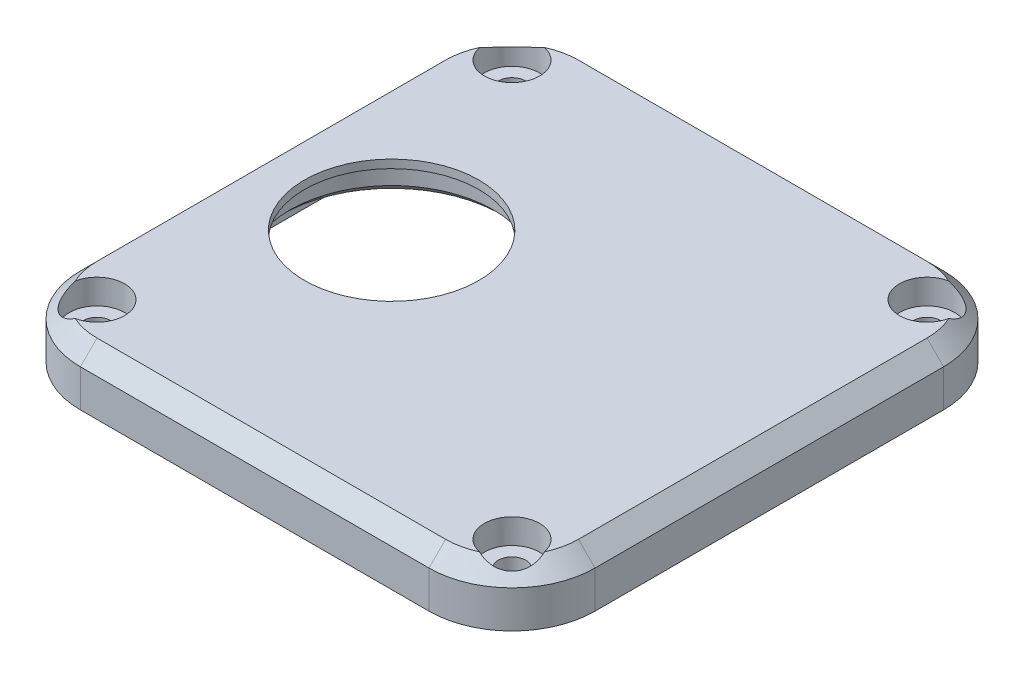
from build123d import *

# Parameters (mm, degrees)
CROQUIS1_W              = 62
CROQUIS1_H              = 62
SALIENTE_EXTRUIR1_DEPTH = 6.5
REDONDEO1_R             = 10
REDONDEO2_R             = 10
VACIADO1_T              = -2.5
SALIENTE_EXTRUIR2_DEPTH = 5
CROQUIS6_R              = 12.25
CORTAR_EXTRUIR4_DEPTH   = 4
CROQUIS8_R              = 10.5
CORTAR_EXTRUIR7_DEPTH   = 70.535961919
CROQUIS9_R              = 1.65
CORTAR_EXTRUIR8_DEPTH   = 70.622194737
CROQUIS10_R             = 3.325
CORTAR_EXTRUIR9_DEPTH   = 3
SALIENTE_EXTRUIR3_START = 1.5
CROQUIS11_R             = 3.910048181
CROQUIS11_R_2           = 1.65
CROQUIS11_R_3           = 3.794929079
CROQUIS11_R_4           = 3.596875763
SALIENTE_EXTRUIR3_DEPTH = 1.5
REDONDEO3_R             = 2
CHAFL_N1_SIZE           = 1
CHAFL_N2_SIZE           = 2
CROQUIS12_R             = 5.75
CORTAR_EXTRUIR10_DEPTH  = 4
CHAFL_N3_SIZE           = 1
CORTAR_EXTRUIR11_DEPTH  = 3
CHAFL_N4_SIZE           = 2


with BuildPart() as part:
    # Croquis1 → Saliente-Extruir1 (new body)
    with BuildSketch(Plane(origin=(0, 0, 0), x_dir=(1, 0, 0), z_dir=(0, 1, 0))):
        with Locations((31, 0)):
            Rectangle(CROQUIS1_W, CROQUIS1_H)
    extrude(amount=SALIENTE_EXTRUIR1_DEPTH)

    # Redondeo1
    redondeo1_edges = [part.edges().sort_by_distance(p)[0] for p in [
        (62, 3.25, -31),
        (62, 3.25, 31),
    ]]
    fillet(redondeo1_edges, radius=REDONDEO1_R)

    # Redondeo2
    redondeo2_edges = [part.edges().sort_by_distance(p)[0] for p in [
        (0, 3.25, -31),
        (0, 3.25, 31),
    ]]
    fillet(redondeo2_edges, radius=REDONDEO2_R)

    # Vaciado1
    vaciado1_openings = [part.faces().sort_by_distance(p)[0] for p in [
        (31, 6.5, 0),
        (31, 0, 0),
    ]]
    offset(amount=VACIADO1_T, openings=vaciado1_openings, kind=Kind.INTERSECTION)

    # Croquis4 → Saliente-Extruir2 (add)
    with BuildSketch(Plane.XZ.offset(-6.5)):
        with BuildLine():
            Line((7.085748882, 28.5), (54.5, 28.5))
            ThreePointArc((54.5, 28.5), (58.035533906, 27.035533906), (59.5, 23.5))
            Line((59.5, 23.5), (59.5, -23.5))
            ThreePointArc((59.5, -23.5), (58.035533906, -27.035533906), (54.5, -28.5))
            Line((54.5, -28.5), (7.085748882, -28.5))
            ThreePointArc((7.085748882, -28.5), (3.550214976, -27.035533906), (2.085748882, -23.5))
            Line((2.085748882, -23.5), (2.085748882, 23.5))
            ThreePointArc((2.085748882, 23.5), (3.550214976, 27.035533906), (7.085748882, 28.5))
        make_face()
    extrude(amount=SALIENTE_EXTRUIR2_DEPTH)

    # Croquis6 → Cortar-Extruir4 (cut)
    with BuildSketch(Plane(origin=(0, 1.5, 0), x_dir=(-1, 0, 0), z_dir=(0, -1, 0))):
        with Locations(Location((-16.5, 0, 0), (0, 0, 90))):
            Circle(CROQUIS6_R)
    extrude(amount=-CORTAR_EXTRUIR4_DEPTH, mode=Mode.SUBTRACT)

    # Croquis8 → Cortar-Extruir7 (cut, through all)
    with BuildSketch(Plane.XZ.offset(-5.5)):
        with Locations(Location((16.5, 0, 0), (0, 0, 270))):
            Circle(CROQUIS8_R)
    extrude(amount=-CORTAR_EXTRUIR7_DEPTH, mode=Mode.SUBTRACT)

    # Croquis9 → Cortar-Extruir8 (cut, through all)
    with BuildSketch(Plane.XZ):
        with Locations(Location((6, 25, 0), (0, 0, 270))):
            Circle(CROQUIS9_R)
        with Locations(Location((56, 25, 0), (0, 0, 270))):
            Circle(CROQUIS9_R)
        with Locations(Location((56, -25, 0), (0, 0, 270))):
            Circle(CROQUIS9_R)
        with Locations(Location((6, -25, 0), (0, 0, 270))):
            Circle(CROQUIS9_R)
    extrude(amount=-CORTAR_EXTRUIR8_DEPTH, mode=Mode.SUBTRACT)

    # Croquis10 → Cortar-Extruir9 (cut)
    with BuildSketch(Plane(origin=(0, 6.5, 0), x_dir=(1, 0, 0), z_dir=(0, 1, 0))):
        with Locations(Location((6, 25, 0), (0, 0, 270))):
            Circle(CROQUIS10_R)
        with Locations(Location((6, -25, 0), (0, 0, 270))):
            Circle(CROQUIS10_R)
        with Locations(Location((56, -25, 0), (0, 0, 270))):
            Circle(CROQUIS10_R)
        with Locations(Location((56, 25, 0), (0, 0, 270))):
            Circle(CROQUIS10_R)
    extrude(amount=-CORTAR_EXTRUIR9_DEPTH, mode=Mode.SUBTRACT)

    # Croquis11 → Saliente-Extruir3 (add)
    # profile 1 of 4: a face of its own
    with BuildSketch(Plane.XZ.offset(-1.5).offset(SALIENTE_EXTRUIR3_START)):
        with Locations((6, 25)):
            Circle(CROQUIS11_R)
        with Locations(Location((6, 25, 0), (0, 0, 270))):
            Circle(CROQUIS11_R_2, mode=Mode.SUBTRACT)
    # profile 2 of 4: a face of its own
    with BuildSketch(Plane.XZ.offset(-1.5).offset(SALIENTE_EXTRUIR3_START)):
        with Locations((6, -25)):
            Circle(CROQUIS11_R_3)
        with Locations(Location((6, -25, 0), (0, 0, 270))):
            Circle(CROQUIS11_R_2, mode=Mode.SUBTRACT)
    # profile 3 of 4: a face of its own
    with BuildSketch(Plane.XZ.offset(-1.5).offset(SALIENTE_EXTRUIR3_START)):
        with Locations((56, -25)):
            Circle(CROQUIS11_R_4)
        with Locations(Location((56, -25, 0), (0, 0, 270))):
            Circle(CROQUIS11_R_2, mode=Mode.SUBTRACT)
    # profile 4 of 4: a face of its own
    with BuildSketch(Plane.XZ.offset(-1.5).offset(SALIENTE_EXTRUIR3_START)):
        with Locations((56, 25)):
            Circle(CROQUIS11_R_4)
        with Locations(Location((56, 25, 0), (0, 0, 270))):
            Circle(CROQUIS11_R_2, mode=Mode.SUBTRACT)
    extrude(amount=-SALIENTE_EXTRUIR3_DEPTH)

    # Redondeo3
    redondeo3_edges = [part.edges().sort_by_distance(p)[0] for p in [
        (54.263904065, 0.75, 28.150156529),
        (59.150156529, 0.75, 23.263904065),
        (59.150156529, 0.75, -23.263904065),
        (54.263904065, 0.75, -28.150156529),
        (7.996337674, 0.75, -28.227401835),
        (2.772598165, 0.75, -23.003662326),
        (2.732409322, 0.75, 22.852599726),
        (8.147400274, 0.75, 28.267590678),
    ]]
    fillet(redondeo3_edges, radius=REDONDEO3_R)

    # Chaflán1
    chafl_n1_edges = [part.edges().sort_by_distance(p)[0] for p in [
        (16.5, 1.5, 12.25),
    ]]
    chamfer(chafl_n1_edges, length=CHAFL_N1_SIZE)

    # Chaflán2
    # the kernel refuses this chamfer: 2 mm, written as the material it takes off along each edge
    with BuildSketch(Plane(origin=(10, 6.5, -31), x_dir=(0, -0.9996219169112968, -0.027495876610585623), z_dir=(1, 0, 0)), Plane(origin=(62, 6.5, -21), x_dir=(0.027495876610585623, -0.9996219169112968, 0), z_dir=(0, 0, 1)), Plane(origin=(52, 6.5, 31), x_dir=(0, -0.9996219169112968, 0.027495876610585623), z_dir=(-1, 0, 0)), Plane(origin=(0, 6.5, 21), x_dir=(-0.027495876610586365, -0.9996219169112968, 0), z_dir=(0, 0, -1))) as chafl_n2_piece_1:
        Polygon((CHAFL_N2_SIZE * 0.999621916911, -CHAFL_N2_SIZE * 0.0274958766106), (-CHAFL_N2_SIZE * 0.0274958766106, -CHAFL_N2_SIZE * 0.999621916911), (0, 0), align=None)
    extrude(amount=42, mode=Mode.SUBTRACT)
    with BuildSketch(Plane(origin=(52, 6.5, 21), x_dir=(1, 0, 0), z_dir=(0, 0, -1))) as chafl_n2_piece_2:
        Polygon((10, CHAFL_N2_SIZE), (10 - CHAFL_N2_SIZE, 0), (10, 0), align=None)
    revolve(axis=Axis((52, 6.5, 21), (0, -1, 0)), revolution_arc=90, mode=Mode.SUBTRACT)
    with BuildSketch(Plane(origin=(52, 6.5, -21), x_dir=(0, 0, -1), z_dir=(-1, 0, 0))) as chafl_n2_piece_3:
        Polygon((10, CHAFL_N2_SIZE), (10 - CHAFL_N2_SIZE, 0), (10, 0), align=None)
    revolve(axis=Axis((52, 6.5, -21), (0, -1, 0)), revolution_arc=90, mode=Mode.SUBTRACT)
    with BuildSketch(Plane(origin=(10, 6.5, -21), x_dir=(0, 0, -1), z_dir=(1, 0, 0))) as chafl_n2_piece_4:
        Polygon((10, -CHAFL_N2_SIZE), (10 - CHAFL_N2_SIZE, 0), (10, 0), align=None)
    revolve(axis=Axis((10, 6.5, -21), (0, 1, 0)), revolution_arc=90, mode=Mode.SUBTRACT)
    with BuildSketch(Plane(origin=(10, 6.5, 21), x_dir=(-1, 0, 0), z_dir=(0, 0, -1))) as chafl_n2_piece_5:
        Polygon((10, -CHAFL_N2_SIZE), (10 - CHAFL_N2_SIZE, 0), (10, 0), align=None)
    revolve(axis=Axis((10, 6.5, 21), (0, 1, 0)), revolution_arc=90, mode=Mode.SUBTRACT)

    # Croquis12 → Cortar-Extruir10 (cut)
    with BuildSketch(Plane.XZ.offset(-1.5)):
        with Locations(Location((44, 0, 0), (0, 0, 270))):
            Circle(CROQUIS12_R)
    extrude(amount=-CORTAR_EXTRUIR10_DEPTH, mode=Mode.SUBTRACT)

    # Chaflán3
    chafl_n3_edges = [part.edges().sort_by_distance(p)[0] for p in [
        (44, 1.5, 5.75),
    ]]
    chamfer(chafl_n3_edges, length=CHAFL_N3_SIZE)

    # Croquis14 → Cortar-Extruir11 (cut)
    with BuildSketch(Plane.XZ.offset(-1.5)):
        with BuildLine():
            Line((20.919533653, 24.89123626), (43.446250752, 24.89123626))
            ThreePointArc((43.446250752, 24.89123626), (44.211617617, 24.738995325), (44.860464315, 24.305449822))
            Line((44.860464315, 24.305449822), (51.391720064, 17.774194073))
            ThreePointArc((51.391720064, 17.774194073), (51.825265567, 17.125347375), (51.977506502, 16.35998051))
            Line((51.977506502, 16.35998051), (51.977506502, 13.625253628))
            ThreePointArc((51.977506502, 13.625253628), (51.391720064, 12.211040066), (49.977506502, 11.625253628))
            Line((49.977506502, 11.625253628), (39.986196606, 11.625253628))
            ThreePointArc((39.986196606, 11.625253628), (39.678099546, 11.649127063), (39.37735782, 11.720177427))
            Line((39.37735782, 11.720177427), (20.310694867, 17.81364703))
            ThreePointArc((20.310694867, 17.81364703), (19.304343638, 18.539248258), (18.919533653, 19.718723232))
            Line((18.919533653, 19.718723232), (18.919533653, 22.89123626))
            ThreePointArc((18.919533653, 22.89123626), (19.505320091, 24.305449822), (20.919533653, 24.89123626))
        make_face()
        with BuildLine():
            Line((18.919533653, -19.718723232), (18.919533653, -22.89123626))
            ThreePointArc((18.919533653, -22.89123626), (19.505320091, -24.305449822), (20.919533653, -24.89123626))
            Line((20.919533653, -24.89123626), (43.446250752, -24.89123626))
            ThreePointArc((43.446250752, -24.89123626), (44.211617617, -24.738995325), (44.860464315, -24.305449822))
            Line((44.860464315, -24.305449822), (51.391720064, -17.774194073))
            ThreePointArc((51.391720064, -17.774194073), (51.825265567, -17.125347375), (51.977506502, -16.35998051))
            Line((51.977506502, -16.35998051), (51.977506502, -13.625253628))
            ThreePointArc((51.977506502, -13.625253628), (51.391720064, -12.211040066), (49.977506502, -11.625253628))
            Line((49.977506502, -11.625253628), (39.986196606, -11.625253628))
            ThreePointArc((39.986196606, -11.625253628), (39.678099546, -11.649127063), (39.37735782, -11.720177427))
            Line((39.37735782, -11.720177427), (20.310694867, -17.81364703))
            ThreePointArc((20.310694867, -17.81364703), (19.304343638, -18.539248258), (18.919533653, -19.718723232))
        make_face()
    extrude(amount=-CORTAR_EXTRUIR11_DEPTH, mode=Mode.SUBTRACT)

    # Chaflán4
    chafl_n4_edges = [part.edges().sort_by_distance(p)[0] for p in [
        (39.678099546, 1.5, 11.649127063),
        (44.981851554, 1.5, 11.625253628),
        (51.391720064, 1.5, 12.211040066),
        (51.977506502, 1.5, 14.992617069),
        (51.825265567, 1.5, 17.125347375),
        (48.12609219, 1.5, 21.039821948),
        (44.211617617, 1.5, 24.738995325),
        (32.182892203, 1.5, 24.89123626),
        (19.505320091, 1.5, 24.305449822),
        (18.919533653, 1.5, 21.304979746),
        (19.304343638, 1.5, 18.539248258),
        (29.844026344, 1.5, 14.766912229),
        (19.505320091, 1.5, -24.305449822),
        (32.182892203, 1.5, -24.89123626),
        (44.211617617, 1.5, -24.738995325),
        (48.12609219, 1.5, -21.039821948),
        (51.825265567, 1.5, -17.125347375),
        (51.977506502, 1.5, -14.992617069),
        (51.391720064, 1.5, -12.211040066),
        (44.981851554, 1.5, -11.625253628),
        (39.678099546, 1.5, -11.649127063),
        (29.844026344, 1.5, -14.766912229),
        (19.304343638, 1.5, -18.539248258),
        (18.919533653, 1.5, -21.304979746),
    ]]
    chamfer(chafl_n4_edges, length=CHAFL_N4_SIZE)


solid = part.part
